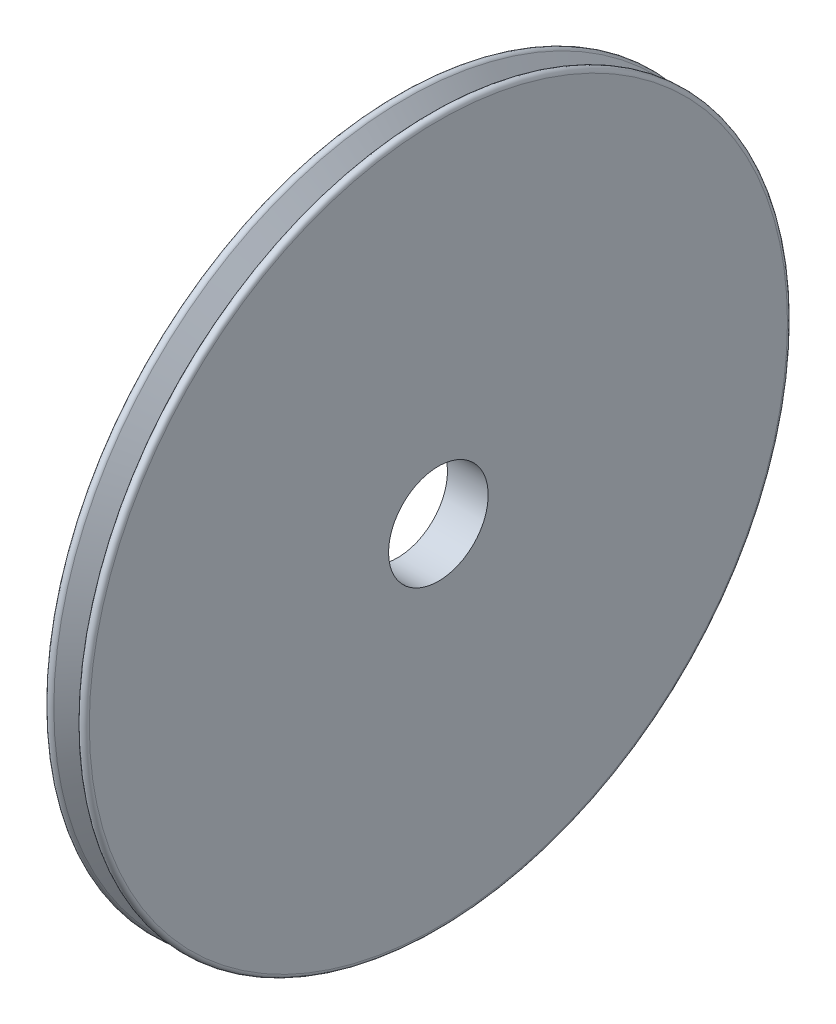
from build123d import *

# Parameters (mm, degrees)
FILLET1_R          = 0.75
SKETCH2_R          = 8.73
CUT_EXTRUDE1_DEPTH = 5


with BuildPart() as part:
    # Sketch1 → Revolve1 (revolve)
    with BuildSketch(Plane.XY):
        Polygon((-3.57, 63.5), (-3.57, 0), (3.57, 0), (3.57, 63.5), (0, 58.5), align=None)
    revolve(axis=Axis((0, 0, 0), (1, 0, 0)))

    # Fillet1
    fillet1_edges = [part.edges().sort_by_distance(p)[0] for p in [
        (-3.57, -63.5, 0),
        (3.57, -63.5, 0),
    ]]
    fillet(fillet1_edges, radius=FILLET1_R)

    # Sketch2 → Cut-Extrude1 (cut, symmetric)
    with BuildSketch(Plane(origin=(0, 0, 0), x_dir=(0, 0, -1), z_dir=(1, 0, 0))):
        Circle(SKETCH2_R)
    extrude(amount=CUT_EXTRUDE1_DEPTH, both=True, mode=Mode.SUBTRACT)


solid = part.part
